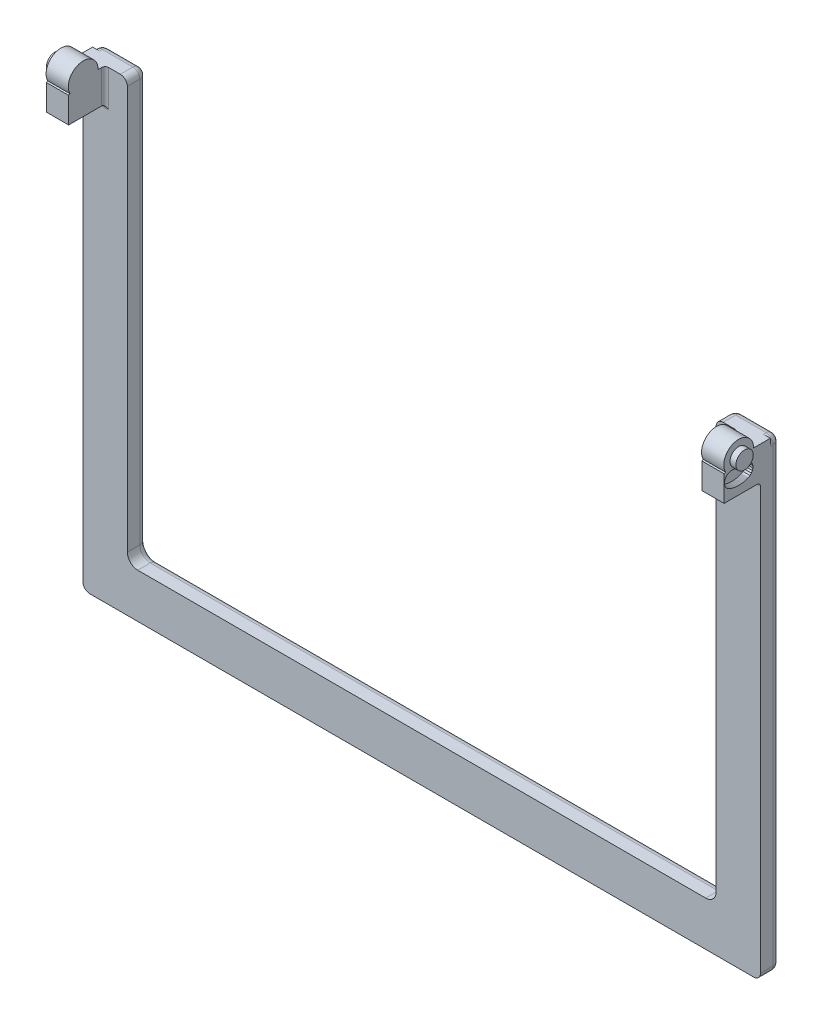
from build123d import *

# Parameters (mm, degrees)
LEFT_LEG_START                = -18.1
LEFT_LEG_DEPTH                = 5.6
FOOT_CROSSBAR_START           = -18.1
FOOT_CROSSBAR_DEPTH           = 5.6
RIGHT_LEG_START               = -18.1
RIGHT_LEG_DEPTH               = 5.6
PIVOT_NECK_0_START            = -2.6
PIVOT_NECK_0_DEPTH            = 6.4
PIVOT_LUG_0_START             = -2.6
PIVOT_LUG_0_PROFILE_R         = 4.3
PIVOT_LUG_0_DEPTH             = 6.4
CAPTIVE_AXLE_0_START          = -4.3
CAPTIVE_AXLE_0_PROFILE_R      = 2.5
CAPTIVE_AXLE_0_DEPTH          = 2
BLIND_ROTATION_GROOVE_0_START = -2.7
BLIND_ROTATION_GROOVE_0_DEPTH = 2.1
PIVOT_NECK_1_START            = 186.2
PIVOT_NECK_1_DEPTH            = 6.4
PIVOT_LUG_1_START             = 186.2
PIVOT_LUG_1_PROFILE_R         = 4.3
PIVOT_LUG_1_DEPTH             = 6.4
CAPTIVE_AXLE_1_START          = 192.3
CAPTIVE_AXLE_1_PROFILE_R      = 2.5
CAPTIVE_AXLE_1_DEPTH          = 2
BLIND_ROTATION_GROOVE_1_START = 190.6
BLIND_ROTATION_GROOVE_1_DEPTH = 2.1
STAND_LEG_ROOT_ROUND_R        = 3
PIVOT_NECK_ROOT_ROUND_R       = 1
STAND_CONTACT_ROUND_R         = 2


with BuildPart() as part:
    # Left_leg_profile → Left_leg (new body)
    with BuildSketch(Plane.XY.offset(LEFT_LEG_START)):
        with BuildLine():
            Line((-0.6, -6.6), (8.2, -6.6))
            ThreePointArc((8.2, -6.6), (9.614213562, -6.014213562), (10.2, -4.6))
            Line((10.2, -4.6), (10.2, 123))
            ThreePointArc((10.2, 123), (9.614213562, 124.414213562), (8.2, 125))
            Line((8.2, 125), (-0.6, 125))
            ThreePointArc((-0.6, 125), (-2.014213562, 124.414213562), (-2.6, 123))
            Line((-2.6, 123), (-2.6, -4.6))
            ThreePointArc((-2.6, -4.6), (-2.014213562, -6.014213562), (-0.6, -6.6))
        make_face()
    extrude(amount=LEFT_LEG_DEPTH)

    # Foot_crossbar_profile → Foot_crossbar (add)
    with BuildSketch(Plane.XY.offset(FOOT_CROSSBAR_START)):
        with BuildLine():
            Line((-0.6, -9), (190.6, -9))
            ThreePointArc((190.6, -9), (192.014213562, -8.414213562), (192.6, -7))
            Line((192.6, -7), (192.6, 1.8))
            ThreePointArc((192.6, 1.8), (192.014213562, 3.214213562), (190.6, 3.8))
            Line((190.6, 3.8), (-0.6, 3.8))
            ThreePointArc((-0.6, 3.8), (-2.014213562, 3.214213562), (-2.6, 1.8))
            Line((-2.6, 1.8), (-2.6, -7))
            ThreePointArc((-2.6, -7), (-2.014213562, -8.414213562), (-0.6, -9))
        make_face()
    extrude(amount=FOOT_CROSSBAR_DEPTH)

    # Right_leg_profile → Right_leg (add)
    with BuildSketch(Plane.XY.offset(RIGHT_LEG_START)):
        with BuildLine():
            Line((181.8, -6.6), (190.6, -6.6))
            ThreePointArc((190.6, -6.6), (192.014213562, -6.014213562), (192.6, -4.6))
            Line((192.6, -4.6), (192.6, 123))
            ThreePointArc((192.6, 123), (192.014213562, 124.414213562), (190.6, 125))
            Line((190.6, 125), (181.8, 125))
            ThreePointArc((181.8, 125), (180.385786438, 124.414213562), (179.8, 123))
            Line((179.8, 123), (179.8, -4.6))
            ThreePointArc((179.8, -4.6), (180.385786438, -6.014213562), (181.8, -6.6))
        make_face()
    extrude(amount=RIGHT_LEG_DEPTH)

    # Pivot_neck_0_profile → Pivot_neck_0 (add)
    with BuildSketch(Plane(origin=(0, 0, 0), x_dir=(0, 0, -1), z_dir=(1, 0, 0)).offset(PIVOT_NECK_0_START)):
        Polygon((15.3, 115.4), (15.3, 125), (6.2, 125), (2, 122.8), (2, 115.4), align=None)
    extrude(amount=PIVOT_NECK_0_DEPTH)

    # Pivot_lug_0_profile → Pivot_lug_0 (add)
    with BuildSketch(Plane(origin=(0, 0, 0), x_dir=(0, 0, -1), z_dir=(1, 0, 0)).offset(PIVOT_LUG_0_START)):
        with Locations((6.2, 125)):
            Circle(PIVOT_LUG_0_PROFILE_R)
    extrude(amount=PIVOT_LUG_0_DEPTH)

    # Captive_axle_0_profile → Captive_axle_0 (add)
    with BuildSketch(Plane(origin=(0, 0, 0), x_dir=(0, 0, -1), z_dir=(1, 0, 0)).offset(CAPTIVE_AXLE_0_START)):
        with Locations((6.2, 125)):
            Circle(CAPTIVE_AXLE_0_PROFILE_R)
    extrude(amount=CAPTIVE_AXLE_0_DEPTH)

    # Blind_rotation_groove_0_profile → Blind_rotation_groove_0 (cut)
    with BuildSketch(Plane(origin=(0, 0, 0), x_dir=(0, 0, -1), z_dir=(1, 0, 0)).offset(BLIND_ROTATION_GROOVE_0_START)):
        Polygon((8.955320713, 118.348067366), (8.736200345, 118.261477327), (8.51436415, 118.182103068), (8.290049676, 118.110029583), (8.063497125, 118.045334051), (7.834949094, 117.988085749), (7.604650319, 117.938345981), (7.372847408, 117.896168009), (7.139788584, 117.861596998), (6.90572341, 117.834669968), (6.67090253, 117.815415753), (6.435577396, 117.80385497), (6.2, 117.8), (5.964422604, 117.80385497), (5.72909747, 117.815415753), (5.49427659, 117.834669968), (5.260211416, 117.861596998), (5.027152592, 117.896168009), (4.795349681, 117.938345981), (4.565050906, 117.988085749), (4.336502875, 118.045334051), (4.109950324, 118.110029583), (3.88563585, 118.182103068), (3.663799655, 118.261477327), (3.444679287, 118.348067366), (2.947307694, 118.635224989), (2.54120549, 119.041327194), (2.254047867, 119.538698786), (2.105404143, 120.093444715), (2.105404143, 120.66775996), (2.254047867, 121.222505889), (2.54120549, 121.719877481), (2.947307694, 122.125979686), (3.444679287, 122.413137309), (3.999425215, 122.561781032), (4.573740461, 122.561781032), (5.128486389, 122.413137309), (5.213699866, 122.379463405), (5.299969497, 122.348595637), (5.387202904, 122.32056706), (5.475306674, 122.295407686), (5.564186464, 122.273144458), (5.653747098, 122.253801215), (5.743892674, 122.23739867), (5.834526662, 122.223954388), (5.925552007, 122.213482765), (6.016871238, 122.205995015), (6.108386568, 122.201499155), (6.2, 122.2), (6.291613432, 122.201499155), (6.383128762, 122.205995015), (6.474447993, 122.213482765), (6.565473338, 122.223954388), (6.656107326, 122.23739867), (6.746252902, 122.253801215), (6.835813536, 122.273144458), (6.924693326, 122.295407686), (7.012797096, 122.32056706), (7.100030503, 122.348595637), (7.186300134, 122.379463405), (7.271513611, 122.413137309), (7.826259539, 122.561781032), (8.400574785, 122.561781032), (8.955320713, 122.413137309), (9.452692306, 122.125979686), (9.85879451, 121.719877481), (10.145952133, 121.222505889), (10.294595857, 120.66775996), (10.294595857, 120.093444715), (10.145952133, 119.538698786), (9.85879451, 119.041327194), (9.452692306, 118.635224989), align=None)
    extrude(amount=BLIND_ROTATION_GROOVE_0_DEPTH, mode=Mode.SUBTRACT)

    # Pivot_neck_1_profile → Pivot_neck_1 (add)
    with BuildSketch(Plane(origin=(0, 0, 0), x_dir=(0, 0, -1), z_dir=(1, 0, 0)).offset(PIVOT_NECK_1_START)):
        Polygon((15.3, 115.4), (15.3, 125), (6.2, 125), (2, 122.8), (2, 115.4), align=None)
    extrude(amount=PIVOT_NECK_1_DEPTH)

    # Pivot_lug_1_profile → Pivot_lug_1 (add)
    with BuildSketch(Plane(origin=(0, 0, 0), x_dir=(0, 0, -1), z_dir=(1, 0, 0)).offset(PIVOT_LUG_1_START)):
        with Locations((6.2, 125)):
            Circle(PIVOT_LUG_1_PROFILE_R)
    extrude(amount=PIVOT_LUG_1_DEPTH)

    # Captive_axle_1_profile → Captive_axle_1 (add)
    with BuildSketch(Plane(origin=(0, 0, 0), x_dir=(0, 0, -1), z_dir=(1, 0, 0)).offset(CAPTIVE_AXLE_1_START)):
        with Locations((6.2, 125)):
            Circle(CAPTIVE_AXLE_1_PROFILE_R)
    extrude(amount=CAPTIVE_AXLE_1_DEPTH)

    # Blind_rotation_groove_1_profile → Blind_rotation_groove_1 (cut)
    with BuildSketch(Plane(origin=(0, 0, 0), x_dir=(0, 0, -1), z_dir=(1, 0, 0)).offset(BLIND_ROTATION_GROOVE_1_START)):
        Polygon((8.955320713, 118.348067366), (8.736200345, 118.261477327), (8.51436415, 118.182103068), (8.290049676, 118.110029583), (8.063497125, 118.045334051), (7.834949094, 117.988085749), (7.604650319, 117.938345981), (7.372847408, 117.896168009), (7.139788584, 117.861596998), (6.90572341, 117.834669968), (6.67090253, 117.815415753), (6.435577396, 117.80385497), (6.2, 117.8), (5.964422604, 117.80385497), (5.72909747, 117.815415753), (5.49427659, 117.834669968), (5.260211416, 117.861596998), (5.027152592, 117.896168009), (4.795349681, 117.938345981), (4.565050906, 117.988085749), (4.336502875, 118.045334051), (4.109950324, 118.110029583), (3.88563585, 118.182103068), (3.663799655, 118.261477327), (3.444679287, 118.348067366), (2.947307694, 118.635224989), (2.54120549, 119.041327194), (2.254047867, 119.538698786), (2.105404143, 120.093444715), (2.105404143, 120.66775996), (2.254047867, 121.222505889), (2.54120549, 121.719877481), (2.947307694, 122.125979686), (3.444679287, 122.413137309), (3.999425215, 122.561781032), (4.573740461, 122.561781032), (5.128486389, 122.413137309), (5.213699866, 122.379463405), (5.299969497, 122.348595637), (5.387202904, 122.32056706), (5.475306674, 122.295407686), (5.564186464, 122.273144458), (5.653747098, 122.253801215), (5.743892674, 122.23739867), (5.834526662, 122.223954388), (5.925552007, 122.213482765), (6.016871238, 122.205995015), (6.108386568, 122.201499155), (6.2, 122.2), (6.291613432, 122.201499155), (6.383128762, 122.205995015), (6.474447993, 122.213482765), (6.565473338, 122.223954388), (6.656107326, 122.23739867), (6.746252902, 122.253801215), (6.835813536, 122.273144458), (6.924693326, 122.295407686), (7.012797096, 122.32056706), (7.100030503, 122.348595637), (7.186300134, 122.379463405), (7.271513611, 122.413137309), (7.826259539, 122.561781032), (8.400574785, 122.561781032), (8.955320713, 122.413137309), (9.452692306, 122.125979686), (9.85879451, 121.719877481), (10.145952133, 121.222505889), (10.294595857, 120.66775996), (10.294595857, 120.093444715), (10.145952133, 119.538698786), (9.85879451, 119.041327194), (9.452692306, 118.635224989), align=None)
    extrude(amount=BLIND_ROTATION_GROOVE_1_DEPTH, mode=Mode.SUBTRACT)

    # Stand_leg_root_round
    stand_leg_root_round_edges = [part.edges().sort_by_distance(p)[0] for p in [
        (10.2, 3.8, -15.3),
        (179.8, 3.8, -15.3),
    ]]
    fillet(stand_leg_root_round_edges, radius=STAND_LEG_ROOT_ROUND_R)

    # Pivot_neck_root_round
    pivot_neck_root_round_edges = [part.edges().sort_by_distance(p)[0] for p in [
        (0.6, 115.4, -12.5),
        (3.8, 120.2, -12.5),
        (189.4, 115.4, -12.5),
        (186.2, 120.2, -12.5),
    ]]
    fillet(pivot_neck_root_round_edges, radius=PIVOT_NECK_ROOT_ROUND_R)

    # Stand_contact_round
    stand_contact_round_edges = [part.edges().sort_by_distance(p)[0] for p in [
        (-2.014213562, 124.414213562, -18.1),
        (192.014213562, 124.414213562, -18.1),
        (3.8, 125, -18.1),
        (9.614213562, 124.414213562, -18.1),
        (-2.6, 58, -18.1),
        (10.2, 64.9, -18.1),
        (-2.014213562, -8.414213562, -18.1),
        (11.078679656, 4.678679656, -18.1),
        (95, -9, -18.1),
        (95, 3.8, -18.1),
        (192.014213562, -8.414213562, -18.1),
        (178.921320344, 4.678679656, -18.1),
        (192.6, 58, -18.1),
        (179.8, 64.9, -18.1),
        (180.385786438, 124.414213562, -18.1),
        (186.2, 125, -18.1),
    ]]
    fillet(stand_contact_round_edges, radius=STAND_CONTACT_ROUND_R)


solid = part.part
